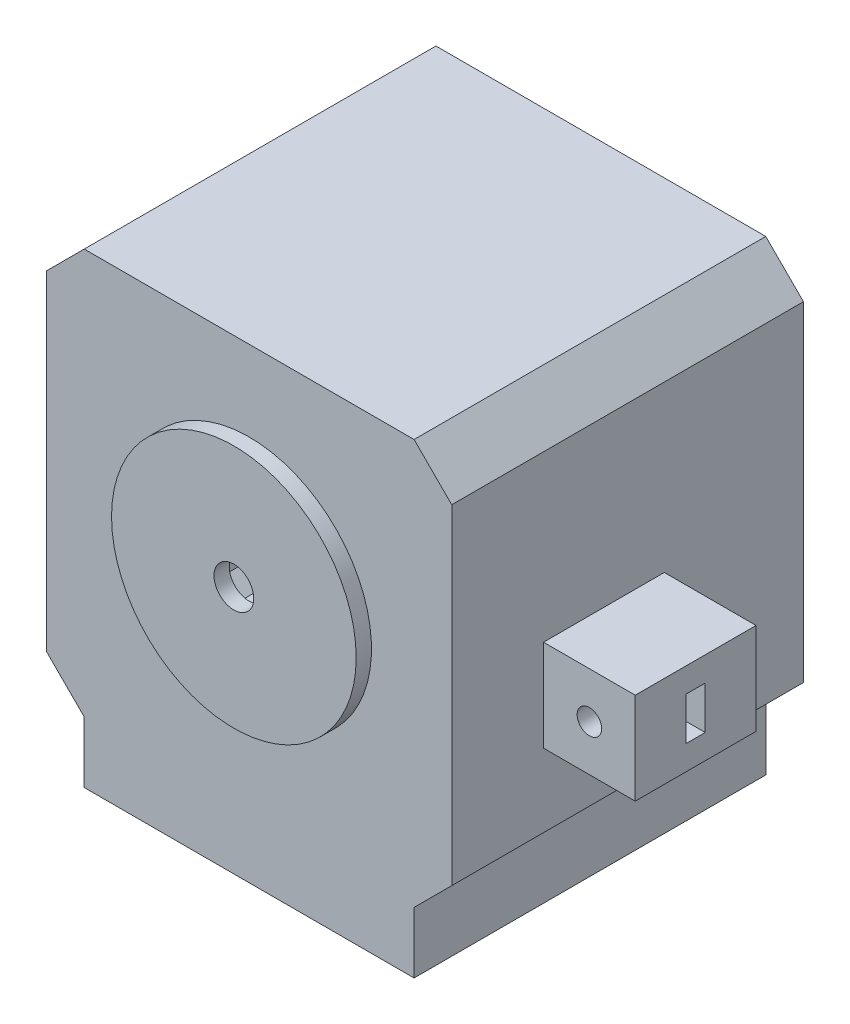
from build123d import *

# Parameters (mm, degrees)
SALIENTE_EXTRUIR1_DEPTH      = 22
CROQUIS2_W                   = 43.142135624
CROQUIS2_H                   = 44
SALIENTE_EXTRUIR2_DEPTH      = 8
CROQUIS3_W                   = 33.76116098
CROQUIS3_H                   = 8
CORTAR_EXTRUIR1_DEPTH        = 49.74935897
CROQUIS4_R                   = 11
SALIENTE_EXTRUIR4_DEPTH      = 2
CROQUIS7_R                   = 16
CROQUIS7_R_2                 = 2.6
SALIENTE_EXTRUIR5_DEPTH      = 2
CROQUIS6_W                   = 28
CROQUIS6_H                   = 12
CORTAR_EXTRUIR3_DEPTH        = 13
SALIENTE_EXTRUIR6_DEPTH      = 12
SALIENTE_EXTRUIR6_DEPTH_BACK = 3.8
CROQUIS8_W                   = 12
CROQUIS8_H                   = 12
CROQUIS8_R                   = 1.6
CROQUIS9_W                   = 2.5
CROQUIS9_H                   = 5.6
CORTAR_EXTRUIR4_DEPTH        = 10


with BuildPart() as part:
    # Croquis1 → Saliente-Extruir1 (new, symmetric)
    with BuildSketch(Plane.XY):
        Polygon((26.5, -21.571067812), (26.5, 21.571067812), (21.571067812, 26.5), (-21.571067812, 26.5), (-26.5, 21.571067812), (-26.5, -21.571067812), (-21.571067812, -26.5), (21.571067812, -26.5), align=None)
        Polygon((-19.5, -21.5), (-21.5, -19.5), (-21.5, 19.5), (-19.5, 21.5), (19.5, 21.5), (21.5, 19.5), (21.5, -19.5), (19.5, -21.5), align=None, mode=Mode.SUBTRACT)
    extrude(amount=SALIENTE_EXTRUIR1_DEPTH, both=True)

    # Croquis2 → Saliente-Extruir2 (add)
    with BuildSketch(Plane.XZ.offset(26.5)):
        Rectangle(CROQUIS2_W, CROQUIS2_H)
    extrude(amount=SALIENTE_EXTRUIR2_DEPTH)

    # Croquis3 → Cortar-Extruir1 (cut, through all)
    with BuildSketch(Plane.XY):
        with Locations((0, -25.5)):
            Rectangle(CROQUIS3_W, CROQUIS3_H)
    extrude(amount=-CORTAR_EXTRUIR1_DEPTH, mode=Mode.SUBTRACT)

    # Croquis4 → Saliente-Extruir4 (add)
    with BuildSketch(Plane(origin=(0, 0, 22), x_dir=(-1, 0, 0), z_dir=(0, 0, -1))):
        Polygon((-26.5, -21.571067812), (-21.571067812, -26.5), (-21.571067812, -34.5), (21.571067812, -34.5), (21.571067812, -26.5), (26.5, -21.571067812), (26.5, 21.571067812), (21.571067812, 26.5), (-21.571067812, 26.5), (-26.5, 21.571067812), align=None)
        Circle(CROQUIS4_R, mode=Mode.SUBTRACT)
    extrude(amount=-SALIENTE_EXTRUIR4_DEPTH)

    # Croquis7 → Saliente-Extruir5 (add)
    with BuildSketch(Plane.XY.offset(24)):
        Circle(CROQUIS7_R)
        Circle(CROQUIS7_R_2, mode=Mode.SUBTRACT)
    extrude(amount=SALIENTE_EXTRUIR5_DEPTH)

    # Croquis6 → Cortar-Extruir3 (cut)
    with BuildSketch(Plane(origin=(0, -29.5, 0), x_dir=(1, 0, 0), z_dir=(0, 1, 0))):
        with Locations((0, 12)):
            Rectangle(CROQUIS6_W, CROQUIS6_H)
    extrude(amount=-CORTAR_EXTRUIR3_DEPTH, mode=Mode.SUBTRACT)

    # Croquis8 → Saliente-Extruir6 (add, two sides: drawn at the far end of the back side and taken through both)
    # profile 1 of 2: a face of its own
    with BuildSketch(Plane.XY.offset(-SALIENTE_EXTRUIR6_DEPTH_BACK)):
        with Locations((-32.5, -6)):
            Rectangle(CROQUIS8_W, CROQUIS8_H)
        with Locations((-32.5, -6)):
            Circle(CROQUIS8_R, mode=Mode.SUBTRACT)
    # profile 2 of 2: a face of its own
    with BuildSketch(Plane.XY.offset(-SALIENTE_EXTRUIR6_DEPTH_BACK)):
        with Locations((32.5, -6)):
            Rectangle(CROQUIS8_W, CROQUIS8_H)
        with Locations((32.5, -6)):
            Circle(CROQUIS8_R, mode=Mode.SUBTRACT)
    extrude(amount=SALIENTE_EXTRUIR6_DEPTH + SALIENTE_EXTRUIR6_DEPTH_BACK)

    # Croquis9 → Cortar-Extruir4 (cut)
    with BuildSketch(Plane(origin=(38.5, 0, 0), x_dir=(0, 0, -1), z_dir=(1, 0, 0))):
        with Locations((-4.1, -6)):
            Rectangle(CROQUIS9_W, CROQUIS9_H)
    cortar_extruir4 = extrude(amount=-CORTAR_EXTRUIR4_DEPTH, mode=Mode.SUBTRACT)

    # Simetría1: Cortar-Extruir4 across plane
    add(cortar_extruir4.mirror(Plane(origin=(0, 0, 0), x_dir=(0, 0, 1), z_dir=(1, 0, 0))), mode=Mode.SUBTRACT)


solid = part.part
